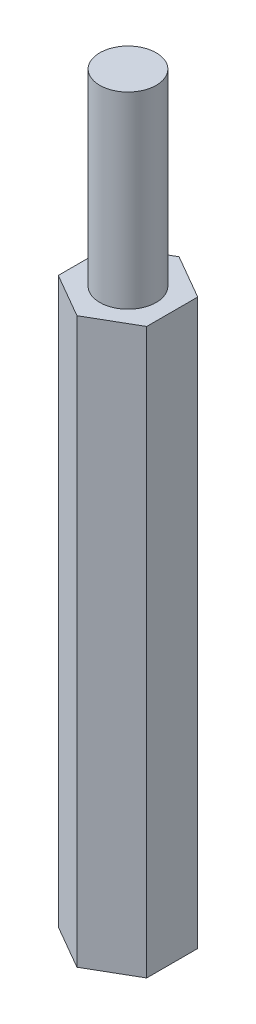
from build123d import *

# Parameters (mm, degrees)
BOSS_EXTRUDE1_DEPTH = 30
SKETCH2_R           = 1.5
BOSS_EXTRUDE2_DEPTH = 10
SKETCH5_R           = 1.5
CUT_EXTRUDE1_DEPTH  = 10


with BuildPart() as part:
    # Sketch1 → Boss-Extrude1 (new body)
    with BuildSketch(Plane(origin=(0, 0, 0), x_dir=(1, 0, 0), z_dir=(0, 1, 0))):
        Polygon((0, 2.713546265), (-2.35, 1.356773133), (-2.35, -1.356773133), (0, -2.713546265), (2.35, -1.356773133), (2.35, 1.356773133), align=None)
    extrude(amount=BOSS_EXTRUDE1_DEPTH)

    # Sketch2 → Boss-Extrude2 (add)
    with BuildSketch(Plane(origin=(0, 30, 0), x_dir=(1, 0, 0), z_dir=(0, 1, 0))):
        Circle(SKETCH2_R)
    extrude(amount=BOSS_EXTRUDE2_DEPTH)

    # Sketch5 → Cut-Extrude1 (cut)
    with BuildSketch(Plane.XZ):
        Circle(SKETCH5_R)
    extrude(amount=-CUT_EXTRUDE1_DEPTH, mode=Mode.SUBTRACT)


solid = part.part
